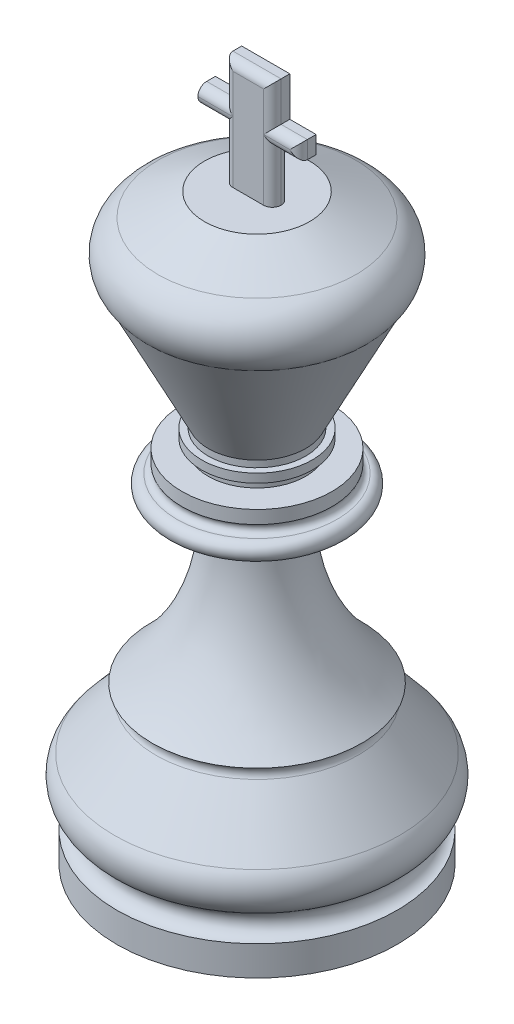
from build123d import *

# Parameters (mm, degrees)
Y_KSEKLIK_EKSTR_ZYON1_DEPTH      = 1
Y_KSEKLIK_EKSTR_ZYON1_DEPTH_BACK = 1
RADYUS1_R                        = 1


with BuildPart() as part:
    # Çizim1 → Döndür2 (revolve)
    with BuildSketch(Plane.XY, mode=Mode.PRIVATE) as d_nd_r2_sk:
        with BuildLine():
            Line((0, 0), (16, 0))
            Line((16, 0), (16, 3.38884098))
            ThreePointArc((16, 3.38884098), (14.671297142, 4.422077286), (15.344126518, 5.964908832))
            ThreePointArc((15.344126518, 5.964908832), (16.983713634, 8.222467989), (16.268743898, 10.919436201))
            Line((16.268743898, 10.919436201), (11.546886806, 16.493906962))
            ThreePointArc((11.546886806, 16.493906962), (11.394303329, 17.319608619), (11.986931159, 17.914467594))
            ThreePointArc((11.986931159, 17.914467594), (6.240844544, 26.416536373), (4.898891797, 36.590122159))
            Line((4.898891797, 36.590122159), (9.141260906, 36.590122159))
            ThreePointArc((9.141260906, 36.590122159), (10.156290654, 37.605151906), (9.141260906, 38.620181653))
            ThreePointArc((9.141260906, 38.620181653), (8.550936954, 38.925677385), (8.564709305, 39.590222593))
            Line((8.564709305, 39.590222593), (8.564709305, 41.090222593))
            Line((8.564709305, 41.090222593), (5.564709305, 41.090222593))
            Line((5.564709305, 41.090222593), (5.564709305, 42.090222593))
            Line((5.564709305, 42.090222593), (6.314709305, 42.090222593))
            Line((6.314709305, 42.090222593), (6.314709305, 43.090222593))
            Line((6.314709305, 43.090222593), (5.564709305, 43.090222593))
            Line((5.564709305, 43.090222593), (5.564709305, 43.840222593))
            Line((5.564709305, 43.840222593), (12.449522519, 57.550572977))
            ThreePointArc((12.449522519, 57.550572977), (13.5024437, 61.024494443), (11.312450275, 63.919438685))
            Line((11.312450275, 63.919438685), (6, 66.5))
            Line((6, 66.5), (0, 66.5))
            Line((0, 66.5), (0, 0))
        make_face()
    revolve(d_nd_r2_sk.sketch.rotate(Axis((0, 88.042217112, 0), (0, -1, 0)), 90), axis=Axis((0, 88.042217112, 0), (0, -1, 0)))

    # Çizim2 → Yükseklik-Ekstrüzyon1 (add, two sides: drawn at the far end of the back side and taken through both)
    with BuildSketch(Plane.XY.offset(-Y_KSEKLIK_EKSTR_ZYON1_DEPTH_BACK)):
        Polygon((-2.75, 66.5), (-2.75, 72.5), (-5.75, 72.5), (-5.75, 74.5), (-2.75, 74.5), (-2.75, 79), (2.75, 79), (2.75, 74.5), (5.75, 74.5), (5.75, 72.5), (2.75, 72.5), (2.75, 66.5), align=None)
    extrude(amount=Y_KSEKLIK_EKSTR_ZYON1_DEPTH + Y_KSEKLIK_EKSTR_ZYON1_DEPTH_BACK)

    # Radyus1
    radyus1_edges = [part.edges().sort_by_distance(p)[0] for p in [
        (-2.75, 69.5, 1),
        (-4.25, 72.5, 1),
        (-4.25, 74.5, 1),
        (-2.75, 76.75, 1),
        (0, 79, 1),
        (2.75, 76.75, 1),
        (4.25, 74.5, 1),
        (5.75, 73.5, 1),
        (4.25, 72.5, 1),
        (2.75, 69.5, -1),
        (2.75, 69.5, 1),
    ]]
    fillet(radyus1_edges, radius=RADYUS1_R - 0.0001)  # a hair under: the kernel refuses the full size


solid = part.part
